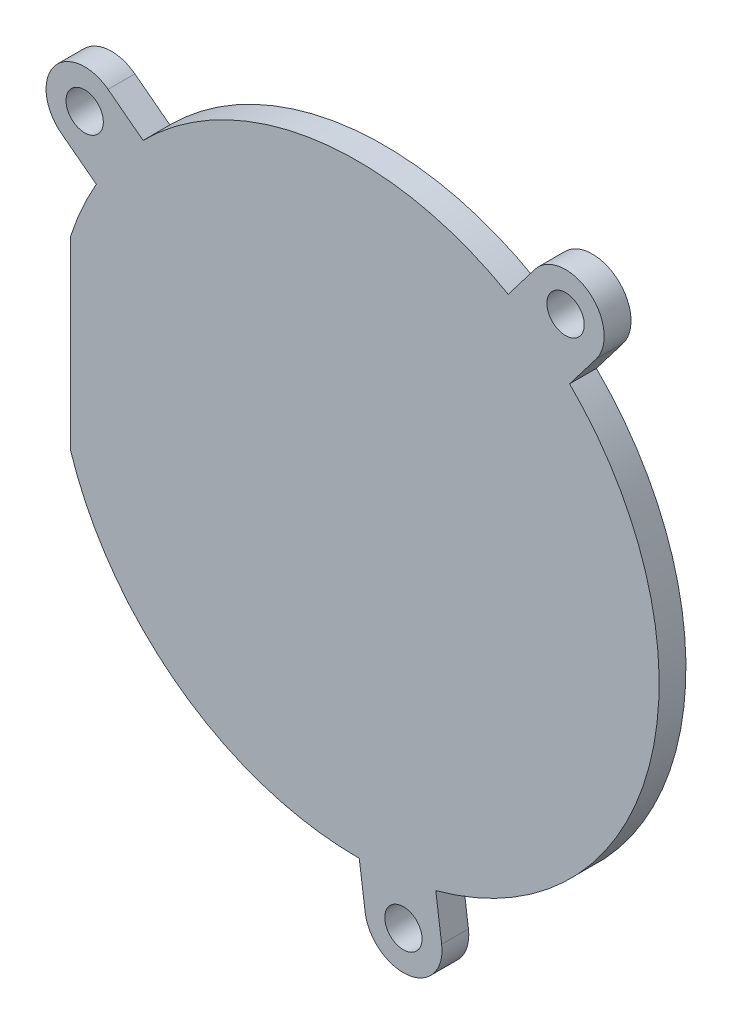
from build123d import *

# Parameters (mm, degrees)
SKETCH1_R           = 1.1049
BOSS_EXTRUDE1_DEPTH = 1.5875


with BuildPart() as part:
    # Sketch1 → Boss-Extrude1 (new body)
    with BuildSketch(Plane.XY):
        with BuildLine():
            Line((-16.984058744, -5.5245), (-16.984058744, 5.5245))
            ThreePointArc((-16.984058744, 5.5245), (-16.316677959, 7.26253207), (-15.471993305, 8.92164642))
            Line((-15.471993305, 8.92164642), (-17.54511156, 10.502250061))
            ThreePointArc((-17.54511156, 10.502250061), (-17.976993058, 13.706164911), (-14.773078207, 14.138046409))
            Line((-14.773078207, 14.138046409), (-12.699959952, 12.557442768))
            ThreePointArc((-12.699959952, 12.557442768), (-2.385909574, 17.699880993), (8.92164642, 15.471993305))
            Line((8.92164642, 15.471993305), (10.502250061, 17.54511156))
            ThreePointArc((10.502250061, 17.54511156), (13.706164911, 17.976993058), (14.138046409, 14.773078207))
            Line((14.138046409, 14.773078207), (12.557442768, 12.699959952))
            ThreePointArc((12.557442768, 12.699959952), (17.265605843, -4.569158189), (4.631794702, -17.248908067))
            Line((4.631794702, -17.248908067), (4.980055125, -19.832479597))
            ThreePointArc((4.980055125, -19.832479597), (3.019931544, -22.40337585), (0.449035291, -20.443252268))
            Line((0.449035291, -20.443252268), (0.100774867, -17.859680739))
            ThreePointArc((0.100774867, -17.859680739), (-10.454687446, -14.480257667), (-16.984058744, -5.5245))
        make_face()
        with Locations((-16.159094884, 12.320148235)):
            Circle(SKETCH1_R, mode=Mode.SUBTRACT)
        with Locations((12.320148235, 16.159094884)):
            Circle(SKETCH1_R, mode=Mode.SUBTRACT)
        with Locations((2.714545208, -20.137865932)):
            Circle(SKETCH1_R, mode=Mode.SUBTRACT)
    extrude(amount=BOSS_EXTRUDE1_DEPTH)


solid = part.part
